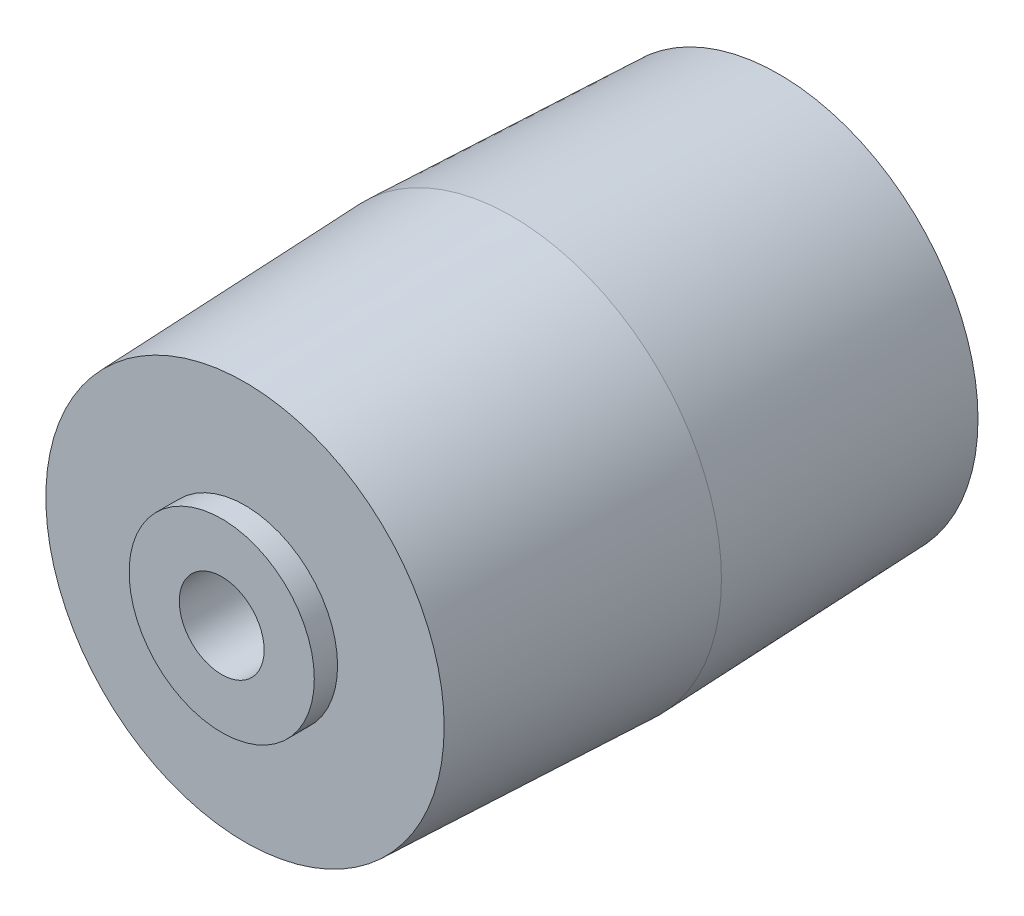
from build123d import *

# Parameters (mm, degrees)
SKETCH2_R          = 1.0414
CUT_EXTRUDE1_DEPTH = 16.998643219


with BuildPart() as part:
    # Sketch1 → Revolve1 (revolve)
    with BuildSketch(Plane(origin=(0, 0, 0), x_dir=(0, 0, -1), z_dir=(1, 0, 0))):
        Polygon((-7.1247, 0), (-7.1247, 2.2733), (-6.5532, 2.2733), (-6.5532, 4.8895), (0, 5.1435), (6.5532, 4.8895), (6.5532, 2.2733), (7.1247, 2.2733), (7.1247, 0), align=None)
    revolve(axis=Axis((0, 0, 7.1247), (0, 0, -1)))

    # Sketch2 → Cut-Extrude1 (cut, through all)
    with BuildSketch(Plane.XY.offset(7.1247)):
        Circle(SKETCH2_R)
    extrude(amount=-CUT_EXTRUDE1_DEPTH, mode=Mode.SUBTRACT)


solid = part.part
